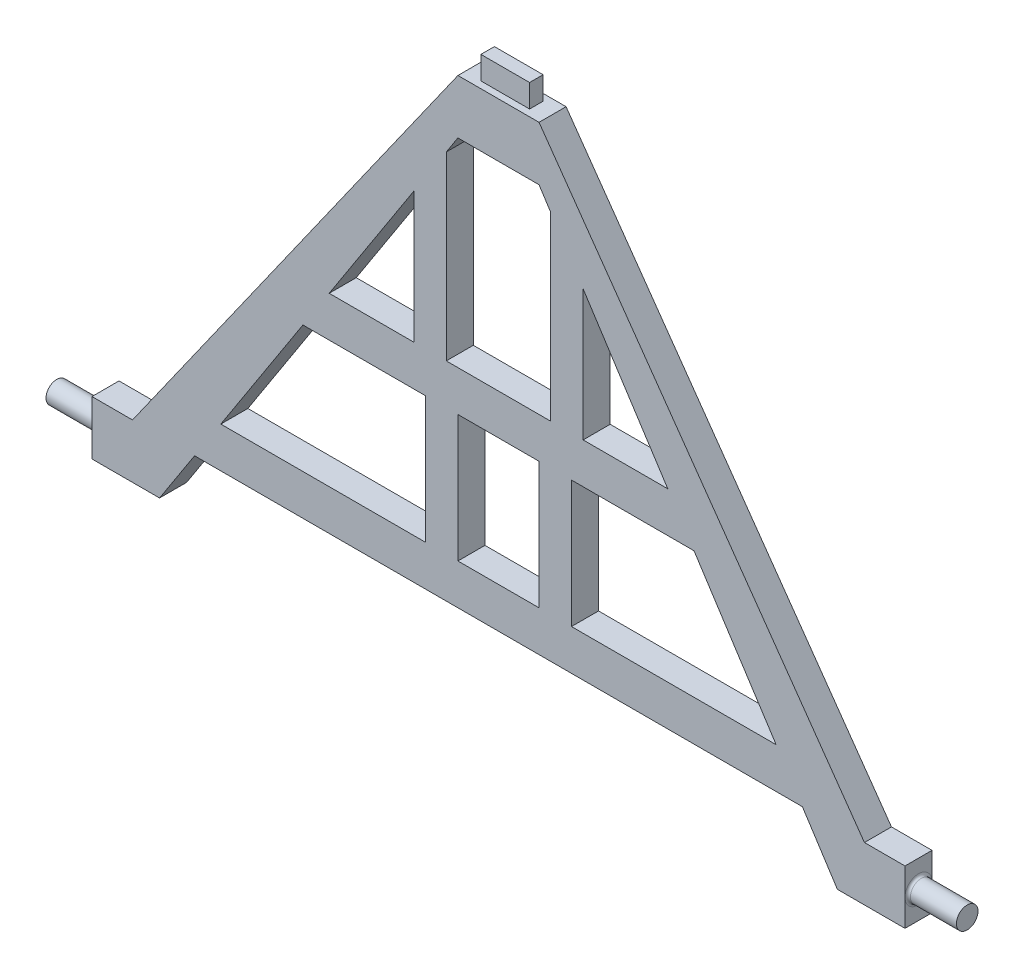
from build123d import *

# Parameters (mm, degrees)
BOSS_EXTRUDE1_DEPTH  = 10
SKETCH6_R            = 4
BOSS_EXTRUDE3_DEPTH  = 18
FILLET2_R            = 1
FILLET2_OF_MIRROR1_R = 1
SKETCH7_W            = 18
SKETCH7_H            = 5
BOSS_EXTRUDE4_DEPTH  = 8.5


with BuildPart() as part:
    # Sketch2 → Boss-Extrude1 (new body)
    with BuildSketch(Plane.XY):
        Polygon((0, 58.642667291), (0, 38.642667291), (15, 38.642667291), (19.305964995, 31.988891988), (19.305964995, -34.929478391), (0, -34.929478391), (0, -49.929478391), (15, -49.929478391), (15, -96.857332709), (0, -96.857332709), (0, -111.857332709), (112.395493867, -111.857332709), (125.33841664, -131.857332709), (150.33841664, -131.857332709), (150.33841664, -111.857332709), (135.33841664, -111.857332709), (15, 58.642667291), align=None)
        Polygon((27, -49.929478391), (72.31912207, -49.929478391), (102.688301787, -96.857332709), (27, -96.857332709), align=None, mode=Mode.SUBTRACT)
        Polygon((31.305964995, -34.929478391), (31.305964995, 13.445939657), (62.61192999, -34.929478391), align=None, mode=Mode.SUBTRACT)
    boss_extrude1 = extrude(amount=BOSS_EXTRUDE1_DEPTH)

    # Sketch6 → Boss-Extrude3 (add)
    with BuildSketch(Plane(origin=(150.33841664, 0, 0), x_dir=(0, 0, -1), z_dir=(1, 0, 0))):
        with Locations(Location((-5, -121.857332709, 0), (0, 0, 90))):
            Circle(SKETCH6_R)
    boss_extrude3 = extrude(amount=BOSS_EXTRUDE3_DEPTH)

    # Fillet2
    fillet2_edges = [part.edges().sort_by_distance(p)[0] for p in [
        (150.33841664, -125.857332709, 5),
    ]]
    fillet(fillet2_edges, radius=FILLET2_R - 0.0001)  # a hair under: the kernel refuses the full size

    # Mirror1: Boss-Extrude1, Boss-Extrude3 across plane
    add(boss_extrude1.mirror(Plane(origin=(0, 0, 10), x_dir=(0, 0, 1), z_dir=(1, 0, 0))))
    add(boss_extrude3.mirror(Plane(origin=(0, 0, 10), x_dir=(0, 0, 1), z_dir=(1, 0, 0))))

    # Fillet2 of Mirror1
    fillet2_of_mirror1_edges = [part.edges().sort_by_distance(p)[0] for p in [
        (-150.33841664, -125.857332709, 5),
    ]]
    fillet(fillet2_of_mirror1_edges, radius=FILLET2_OF_MIRROR1_R - 0.0001)  # a hair under: the kernel refuses the full size

    # Sketch7 → Boss-Extrude4 (add)
    with BuildSketch(Plane(origin=(0, 58.642667291, 0), x_dir=(1, 0, 0), z_dir=(0, 1, 0))):
        with Locations((0, -5)):
            Rectangle(SKETCH7_W, SKETCH7_H)
    extrude(amount=BOSS_EXTRUDE4_DEPTH)


solid = part.part
